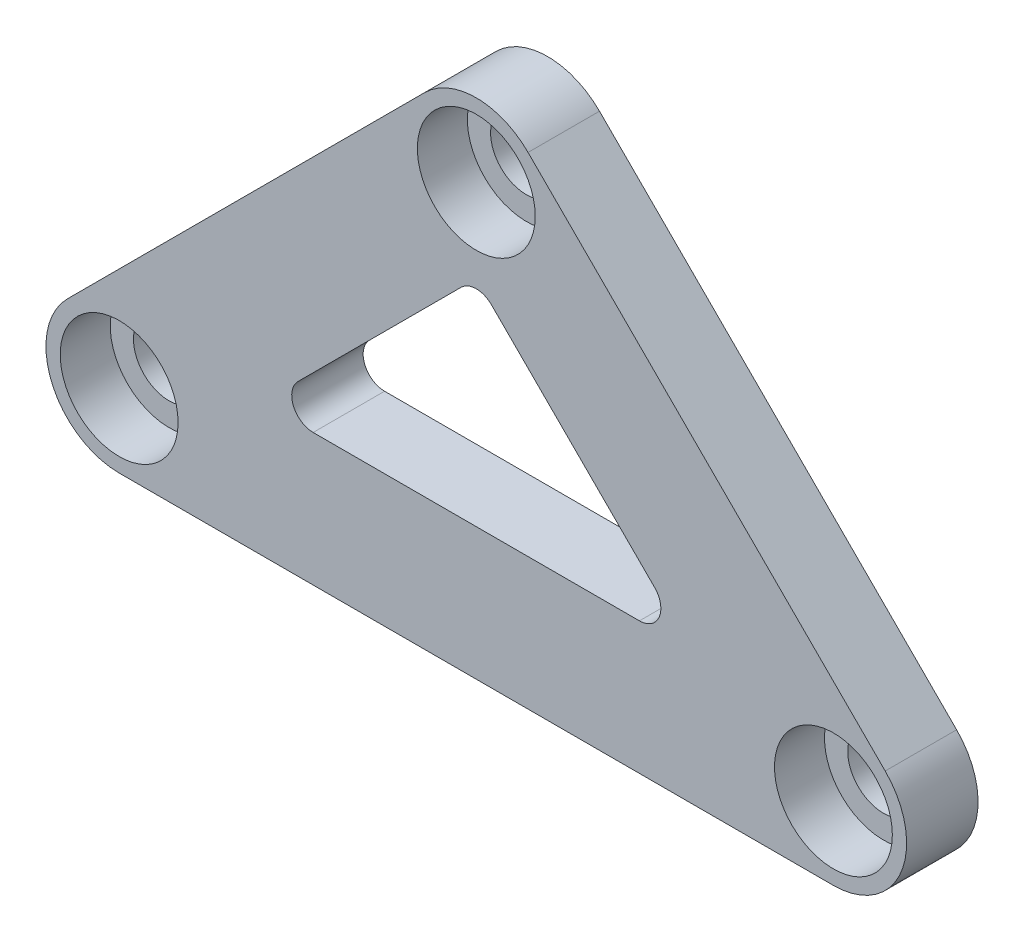
from build123d import *

# Parameters (mm, degrees)
BOSS_EXTRUDE1_DEPTH = 10
SKETCH2_R           = 8.25
CUT_EXTRUDE1_DEPTH  = 7
CUT_EXTRUDE2_DEPTH  = 16
FILLET2_R           = 3
SKETCH5_R           = 5
CUT_EXTRUDE3_DEPTH  = 16


with BuildPart() as part:
    # Sketch1 → Boss-Extrude1 (new body)
    with BuildSketch(Plane.XY):
        with BuildLine():
            Line((42.752155493, 57.247844507), (-7.247844507, 7.247844507))
            ThreePointArc((-7.247844507, 7.247844507), (-9.469765208, -3.922505182), (0, -10.25))
            Line((0, -10.25), (100, -10.25))
            ThreePointArc((100, -10.25), (109.469765208, -3.922505182), (107.247844507, 7.247844507))
            Line((107.247844507, 7.247844507), (57.247844507, 57.247844507))
            ThreePointArc((57.247844507, 57.247844507), (50, 60.25), (42.752155493, 57.247844507))
        make_face()
        Polygon((24.745689014, 10.25), (50, 35.504310986), (75.254310986, 10.25), align=None, mode=Mode.SUBTRACT)
    extrude(amount=BOSS_EXTRUDE1_DEPTH)

    # Sketch2 → Cut-Extrude1 (cut)
    with BuildSketch(Plane.XY.offset(10)):
        with Locations((50, 50)):
            Circle(SKETCH2_R)
        with Locations((100, 0)):
            Circle(SKETCH2_R)
        Circle(SKETCH2_R)
    extrude(amount=-CUT_EXTRUDE1_DEPTH, mode=Mode.SUBTRACT)

    # Sketch4 → Cut-Extrude2 (cut)
    with BuildSketch(Plane.XY.offset(10)):
        Polygon((19.91726189, 8.25), (80.08273811, 8.25), (50, 38.33273811), align=None)
    extrude(amount=-CUT_EXTRUDE2_DEPTH, mode=Mode.SUBTRACT)

    # Fillet2
    fillet2_edges = [part.edges().sort_by_distance(p)[0] for p in [
        (80.08273811, 8.25, 5),
        (19.91726189, 8.25, 5),
        (50, 38.33273811, 5),
    ]]
    fillet(fillet2_edges, radius=FILLET2_R)

    # Sketch5 → Cut-Extrude3 (cut)
    with BuildSketch(Plane.XY.offset(10)):
        Circle(SKETCH5_R)
        with Locations((50, 50)):
            Circle(SKETCH5_R)
        with Locations((100, 0)):
            Circle(SKETCH5_R)
    extrude(amount=-CUT_EXTRUDE3_DEPTH, mode=Mode.SUBTRACT)


solid = part.part
